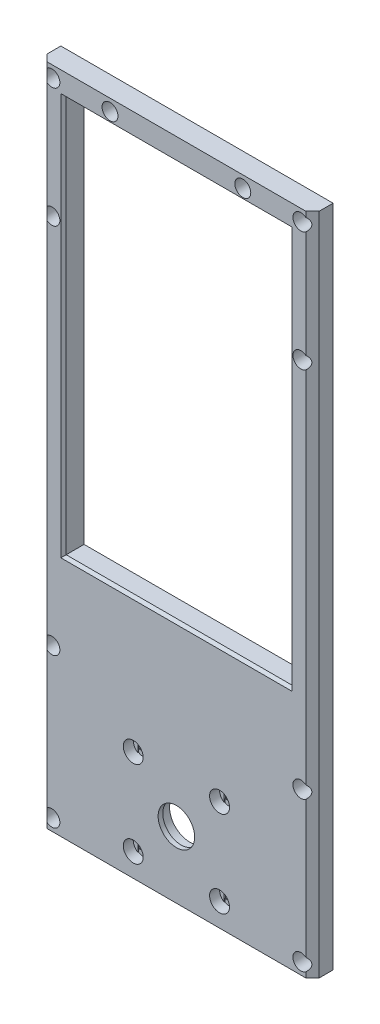
from build123d import *

# Parameters (mm, degrees)
SKETCH1_W           = 82
SKETCH1_H           = 200
SKETCH1_W_2         = 68
SKETCH1_H_2         = 186
BOSS_EXTRUDE1_DEPTH = 7
SKETCH2_W           = 68
SKETCH2_H           = 36
BOSS_EXTRUDE2_DEPTH = 7
SKETCH3_R           = 5.5
CUT_EXTRUDE1_DEPTH  = 109.305124532
SKETCH4_R           = 6.05
CUT_EXTRUDE2_DEPTH  = 5.6
SKETCH5_R           = 11
CUT_EXTRUDE3_DEPTH  = 3
SKETCH6_R           = 1.6
CUT_EXTRUDE4_DEPTH  = 109.305124532
SKETCH7_W           = 50
SKETCH7_H           = 38
CUT_EXTRUDE5_DEPTH  = 1
SKETCH8_R           = 3
CUT_EXTRUDE6_DEPTH  = 3
SKETCH9_R           = 1.35
CUT_EXTRUDE7_DEPTH  = 109.305124532
SKETCH10_R          = 2.4
CUT_EXTRUDE8_DEPTH  = 5
CHAMFER1_SIZE       = 2
SKETCH11_W          = 68
SKETCH11_H          = 30.5
BOSS_EXTRUDE3_DEPTH = 7
SKETCH12_R          = 1.35
CUT_EXTRUDE9_DEPTH  = 109.305124532
SKETCH13_R          = 2.4
CUT_EXTRUDE10_DEPTH = 5
CHAMFER2_SIZE       = 0.8
CUT_EXTRUDE11_DEPTH = 0.2
SKETCH15_W          = 2.7
SKETCH15_H          = 2.7
CUT_EXTRUDE12_DEPTH = 0.2
CUT_EXTRUDE13_DEPTH = 0.2
SKETCH17_W          = 3.2
SKETCH17_H          = 3.2
CUT_EXTRUDE14_DEPTH = 0.2


with BuildPart() as part:
    # Sketch1 → Boss-Extrude1 (new body)
    with BuildSketch(Plane.XY):
        Rectangle(SKETCH1_W, SKETCH1_H)
        Rectangle(SKETCH1_W_2, SKETCH1_H_2, mode=Mode.SUBTRACT)
    extrude(amount=BOSS_EXTRUDE1_DEPTH)

    # Sketch2 → Boss-Extrude2 (add)
    with BuildSketch(Plane.XY.offset(7)):
        with Locations((0, -75)):
            Rectangle(SKETCH2_W, SKETCH2_H)
    extrude(amount=-BOSS_EXTRUDE2_DEPTH)

    # Sketch3 → Cut-Extrude1 (cut, through all)
    with BuildSketch(Plane(origin=(0, 0, 0), x_dir=(-1, 0, 0), z_dir=(0, 0, -1))):
        with Locations((0, -80)):
            Circle(SKETCH3_R)
    extrude(amount=-CUT_EXTRUDE1_DEPTH, mode=Mode.SUBTRACT)

    # Sketch4 → Cut-Extrude2 (cut)
    with BuildSketch(Plane(origin=(0, 0, 0), x_dir=(-1, 0, 0), z_dir=(0, 0, -1))):
        with Locations((0, -80)):
            Circle(SKETCH4_R)
    extrude(amount=-CUT_EXTRUDE2_DEPTH, mode=Mode.SUBTRACT)

    # Sketch5 → Cut-Extrude3 (cut)
    with BuildSketch(Plane(origin=(0, 0, 0), x_dir=(-1, 0, 0), z_dir=(0, 0, -1))):
        with Locations((0, -80)):
            Circle(SKETCH5_R)
    extrude(amount=-CUT_EXTRUDE3_DEPTH, mode=Mode.SUBTRACT)

    # Sketch6 → Cut-Extrude4 (cut, through all)
    with BuildSketch(Plane(origin=(0, 0, 0), x_dir=(-1, 0, 0), z_dir=(0, 0, -1))):
        with Locations((-13, -67)):
            Circle(SKETCH6_R)
        with Locations((13, -67)):
            Circle(SKETCH6_R)
        with Locations((13, -93)):
            Circle(SKETCH6_R)
        with Locations((-13, -93)):
            Circle(SKETCH6_R)
    extrude(amount=-CUT_EXTRUDE4_DEPTH, mode=Mode.SUBTRACT)

    # Sketch7 → Cut-Extrude5 (cut)
    with BuildSketch(Plane(origin=(0, 0, 0), x_dir=(-1, 0, 0), z_dir=(0, 0, -1))):
        with Locations((0, -80)):
            Rectangle(SKETCH7_W, SKETCH7_H)
    extrude(amount=-CUT_EXTRUDE5_DEPTH, mode=Mode.SUBTRACT)

    # Sketch8 → Cut-Extrude6 (cut)
    with BuildSketch(Plane.XY.offset(7)):
        with Locations((-13, -67)):
            Circle(SKETCH8_R)
        with Locations((13, -67)):
            Circle(SKETCH8_R)
        with Locations((13, -93)):
            Circle(SKETCH8_R)
        with Locations((-13, -93)):
            Circle(SKETCH8_R)
    extrude(amount=-CUT_EXTRUDE6_DEPTH, mode=Mode.SUBTRACT)

    # Sketch9 → Cut-Extrude7 (cut, through all)
    with BuildSketch(Plane.XY.offset(7)):
        with Locations((-37.5, 96.5)):
            Circle(SKETCH9_R)
        with Locations((37.5, 96.5)):
            Circle(SKETCH9_R)
        with Locations((-37.5, -96.5)):
            Circle(SKETCH9_R)
        with Locations((37.5, -96.5)):
            Circle(SKETCH9_R)
        with Locations((-37.5, 60.5)):
            Circle(SKETCH9_R)
        with Locations((37.5, 60.5)):
            Circle(SKETCH9_R)
        with Locations((37.5, -51.5)):
            Circle(SKETCH9_R)
        with Locations((-37.5, -51.5)):
            Circle(SKETCH9_R)
    extrude(amount=-CUT_EXTRUDE7_DEPTH, mode=Mode.SUBTRACT)

    # Sketch10 → Cut-Extrude8 (cut)
    with BuildSketch(Plane.XY.offset(7)):
        with Locations((-37.5, 96.5)):
            Circle(SKETCH10_R)
        with Locations((37.5, 60.5)):
            Circle(SKETCH10_R)
        with Locations((-37.5, 60.5)):
            Circle(SKETCH10_R)
        with Locations((37.5, 96.5)):
            Circle(SKETCH10_R)
        with Locations((-37.5, -96.5)):
            Circle(SKETCH10_R)
        with Locations((37.5, -96.5)):
            Circle(SKETCH10_R)
        with Locations((-37.5, -51.5)):
            Circle(SKETCH10_R)
        with Locations((37.5, -51.5)):
            Circle(SKETCH10_R)
    extrude(amount=-CUT_EXTRUDE8_DEPTH, mode=Mode.SUBTRACT)

    # Chamfer1
    # the kernel refuses this chamfer: 2 mm, written as the material it takes off along each edge
    with BuildSketch(Plane(origin=(-41, 105.143365976, 7), x_dir=(-0.027495876610585623, 0, -0.9996219169112968), z_dir=(0, -1, 0)), Plane(origin=(41, -105.143365976, 7), x_dir=(0.027495876610585623, 0, -0.9996219169112968), z_dir=(0, 1, 0))) as chamfer1_piece_1:
        Polygon((CHAMFER1_SIZE * 0.999621916911, CHAMFER1_SIZE * 0.0274958766106), (-CHAMFER1_SIZE * 0.0274958766106, CHAMFER1_SIZE * 0.999621916911), (0, 0), align=None)
    extrude(amount=210.286731952, mode=Mode.SUBTRACT)

    # Sketch11 → Boss-Extrude3 (add)
    with BuildSketch(Plane.XY.offset(7)):
        with Locations((0, -41.75)):
            Rectangle(SKETCH11_W, SKETCH11_H)
    extrude(amount=-BOSS_EXTRUDE3_DEPTH)

    # Sketch12 → Cut-Extrude9 (cut, through all)
    with BuildSketch(Plane.XY.offset(7)):
        with Locations((-20, 96.5)):
            Circle(SKETCH12_R)
        with Locations((20, 96.5)):
            Circle(SKETCH12_R)
    extrude(amount=-CUT_EXTRUDE9_DEPTH, mode=Mode.SUBTRACT)

    # Sketch13 → Cut-Extrude10 (cut)
    with BuildSketch(Plane.XY.offset(7)):
        with Locations((-20, 96.5)):
            Circle(SKETCH13_R)
        with Locations((20, 96.5)):
            Circle(SKETCH13_R)
    extrude(amount=-CUT_EXTRUDE10_DEPTH, mode=Mode.SUBTRACT)

    # Chamfer2
    chamfer2_edges = [part.edges().sort_by_distance(p)[0] for p in [
        (0, 93, 0),
        (-34, 33.25, 0),
        (0, 93, 7),
        (-34, 33.25, 7),
        (34, 33.25, 7),
        (34, 33.25, 0),
        (0, -26.5, 7),
        (0, -26.5, 0),
        (0, -100, 0),
        (-41, 0, 0),
        (0, 100, 0),
        (41, 0, 0),
    ]]
    chamfer(chamfer2_edges, length=CHAMFER2_SIZE)

    # Sketch14 → Cut-Extrude11 (cut)
    with BuildSketch(Plane.XY.offset(2)):
        with BuildLine():
            Line((-38.85, -53.484313483), (-38.85, -49.515686517))
            ThreePointArc((-38.85, -49.515686517), (-37.5, -49.1), (-36.15, -49.515686517))
            Line((-36.15, -49.515686517), (-36.15, -53.484313483))
            ThreePointArc((-36.15, -53.484313483), (-37.5, -53.9), (-38.85, -53.484313483))
        make_face()
        with BuildLine():
            Line((-38.85, -98.484313483), (-38.85, -94.515686517))
            ThreePointArc((-38.85, -94.515686517), (-37.5, -94.1), (-36.15, -94.515686517))
            Line((-36.15, -94.515686517), (-36.15, -98.484313483))
            ThreePointArc((-36.15, -98.484313483), (-37.5, -98.9), (-38.85, -98.484313483))
        make_face()
        with BuildLine():
            Line((-38.85, 58.515686517), (-38.85, 62.484313483))
            ThreePointArc((-38.85, 62.484313483), (-37.5, 62.9), (-36.15, 62.484313483))
            Line((-36.15, 62.484313483), (-36.15, 58.515686517))
            ThreePointArc((-36.15, 58.515686517), (-37.5, 58.1), (-38.85, 58.515686517))
        make_face()
        with BuildLine():
            Line((-21.35, 94.515686517), (-21.35, 98.484313483))
            ThreePointArc((-21.35, 98.484313483), (-20, 98.9), (-18.65, 98.484313483))
            Line((-18.65, 98.484313483), (-18.65, 94.515686517))
            ThreePointArc((-18.65, 94.515686517), (-20, 94.1), (-21.35, 94.515686517))
        make_face()
        with BuildLine():
            Line((-38.85, 94.515686517), (-38.85, 98.484313483))
            ThreePointArc((-38.85, 98.484313483), (-37.5, 98.9), (-36.15, 98.484313483))
            Line((-36.15, 98.484313483), (-36.15, 94.515686517))
            ThreePointArc((-36.15, 94.515686517), (-37.5, 94.1), (-38.85, 94.515686517))
        make_face()
    cut_extrude11 = extrude(amount=-CUT_EXTRUDE11_DEPTH, mode=Mode.SUBTRACT)

    # Sketch15 → Cut-Extrude12 (cut)
    with BuildSketch(Plane.XY.offset(1.8)):
        with Locations((-37.5, -96.5)):
            Rectangle(SKETCH15_W, SKETCH15_H)
        with Locations((-37.5, -51.5)):
            Rectangle(SKETCH15_W, SKETCH15_H)
        with Locations((-37.5, 60.5)):
            Rectangle(SKETCH15_W, SKETCH15_H)
        with Locations((-37.5, 96.5)):
            Rectangle(SKETCH15_W, SKETCH15_H)
        with Locations((-20, 96.5)):
            Rectangle(SKETCH15_W, SKETCH15_H)
    cut_extrude12 = extrude(amount=-CUT_EXTRUDE12_DEPTH, mode=Mode.SUBTRACT)

    # Sketch16 → Cut-Extrude13 (cut)
    with BuildSketch(Plane.XY.offset(4)):
        with BuildLine():
            Line((-14.6, -69.537715508), (-14.6, -64.462284492))
            ThreePointArc((-14.6, -64.462284492), (-13, -64), (-11.4, -64.462284492))
            Line((-11.4, -64.462284492), (-11.4, -69.537715508))
            ThreePointArc((-11.4, -69.537715508), (-13, -70), (-14.6, -69.537715508))
        make_face()
        with BuildLine():
            Line((-14.6, -95.537715508), (-14.6, -90.462284492))
            ThreePointArc((-14.6, -90.462284492), (-13, -90), (-11.4, -90.462284492))
            Line((-11.4, -90.462284492), (-11.4, -95.537715508))
            ThreePointArc((-11.4, -95.537715508), (-13, -96), (-14.6, -95.537715508))
        make_face()
    cut_extrude13 = extrude(amount=-CUT_EXTRUDE13_DEPTH, mode=Mode.SUBTRACT)

    # Sketch17 → Cut-Extrude14 (cut)
    with BuildSketch(Plane.XY.offset(3.8)):
        with Locations((-13, -67)):
            Rectangle(SKETCH17_W, SKETCH17_H)
        with Locations((-13, -93)):
            Rectangle(SKETCH17_W, SKETCH17_H)
    cut_extrude14 = extrude(amount=-CUT_EXTRUDE14_DEPTH, mode=Mode.SUBTRACT)

    # Mirror1: Cut-Extrude11, Cut-Extrude12, Cut-Extrude13, Cut-Extrude14 across plane
    add(cut_extrude11.mirror(Plane(origin=(0, 0, 0), x_dir=(0, 0, 1), z_dir=(1, 0, 0))), mode=Mode.SUBTRACT)
    add(cut_extrude12.mirror(Plane(origin=(0, 0, 0), x_dir=(0, 0, 1), z_dir=(1, 0, 0))), mode=Mode.SUBTRACT)
    add(cut_extrude13.mirror(Plane(origin=(0, 0, 0), x_dir=(0, 0, 1), z_dir=(1, 0, 0))), mode=Mode.SUBTRACT)
    add(cut_extrude14.mirror(Plane(origin=(0, 0, 0), x_dir=(0, 0, 1), z_dir=(1, 0, 0))), mode=Mode.SUBTRACT)


solid = part.part
